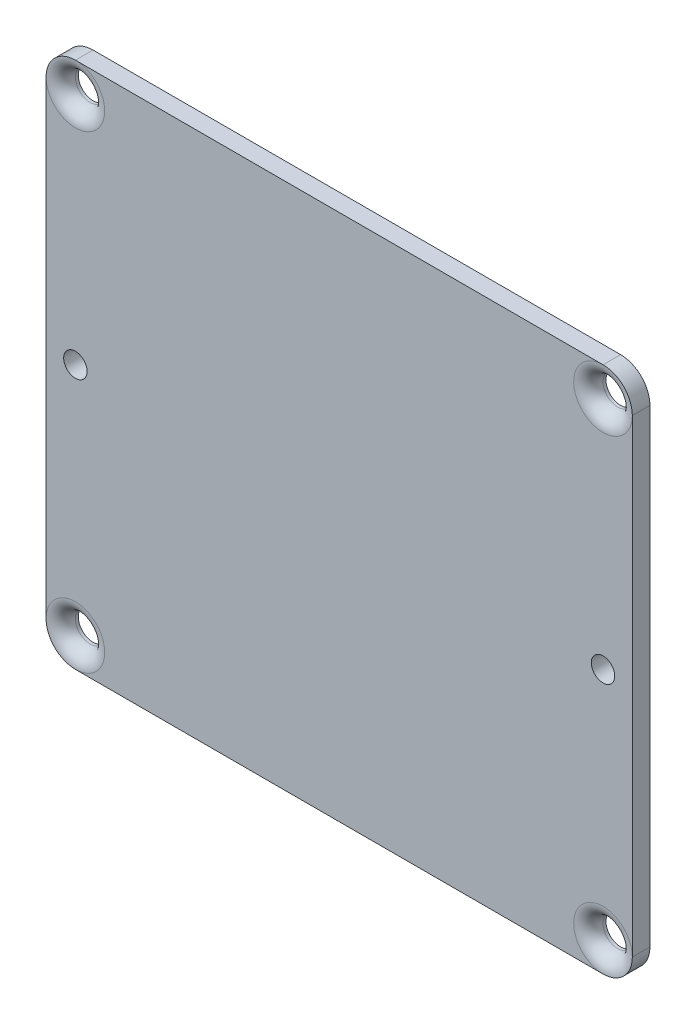
from build123d import *

# Parameters (mm, degrees)
SKETCH2_W           = 127
SKETCH2_H           = 114.3
SKETCH2_R           = 3.175
SKETCH2_R_2         = 2.54
BOSS_EXTRUDE2_DEPTH = 3.81
FILLET1_R           = 3.175
FILLET2_R           = 6.35


with BuildPart() as part:
    # Sketch2 → Boss-Extrude2 (new body)
    with BuildSketch(Plane.XY):
        with Locations((63.5, 57.15)):
            Rectangle(SKETCH2_W, SKETCH2_H)
        with Locations(Location((6.35, 107.95, 0), (0, 0, 180))):
            Circle(SKETCH2_R, mode=Mode.SUBTRACT)
        with Locations(Location((120.65, 107.95, 0), (0, 0, 180))):
            Circle(SKETCH2_R, mode=Mode.SUBTRACT)
        with Locations(Location((120.65, 6.35, 0), (0, 0, 180))):
            Circle(SKETCH2_R, mode=Mode.SUBTRACT)
        with Locations(Location((6.35, 6.35, 0), (0, 0, 180))):
            Circle(SKETCH2_R, mode=Mode.SUBTRACT)
        with Locations(Location((6.35, 57.15, 0), (0, 0, 180))):
            Circle(SKETCH2_R_2, mode=Mode.SUBTRACT)
        with Locations(Location((120.65, 57.15, 0), (0, 0, 180))):
            Circle(SKETCH2_R_2, mode=Mode.SUBTRACT)
    extrude(amount=BOSS_EXTRUDE2_DEPTH)

    # Fillet1
    fillet1_edges = [part.edges().sort_by_distance(p)[0] for p in [
        (123.825, 107.95, 3.81),
        (9.525, 107.95, 3.81),
        (9.525, 6.35, 3.81),
        (123.825, 6.35, 3.81),
    ]]
    fillet(fillet1_edges, radius=FILLET1_R - 0.0001)  # a hair under: the kernel refuses the full size

    # Fillet2
    fillet2_edges = [part.edges().sort_by_distance(p)[0] for p in [
        (127, 114.3, 1.905),
        (127, 0, 1.905),
        (0, 0, 1.905),
        (0, 114.3, 1.905),
    ]]
    fillet(fillet2_edges, radius=FILLET2_R)


solid = part.part
